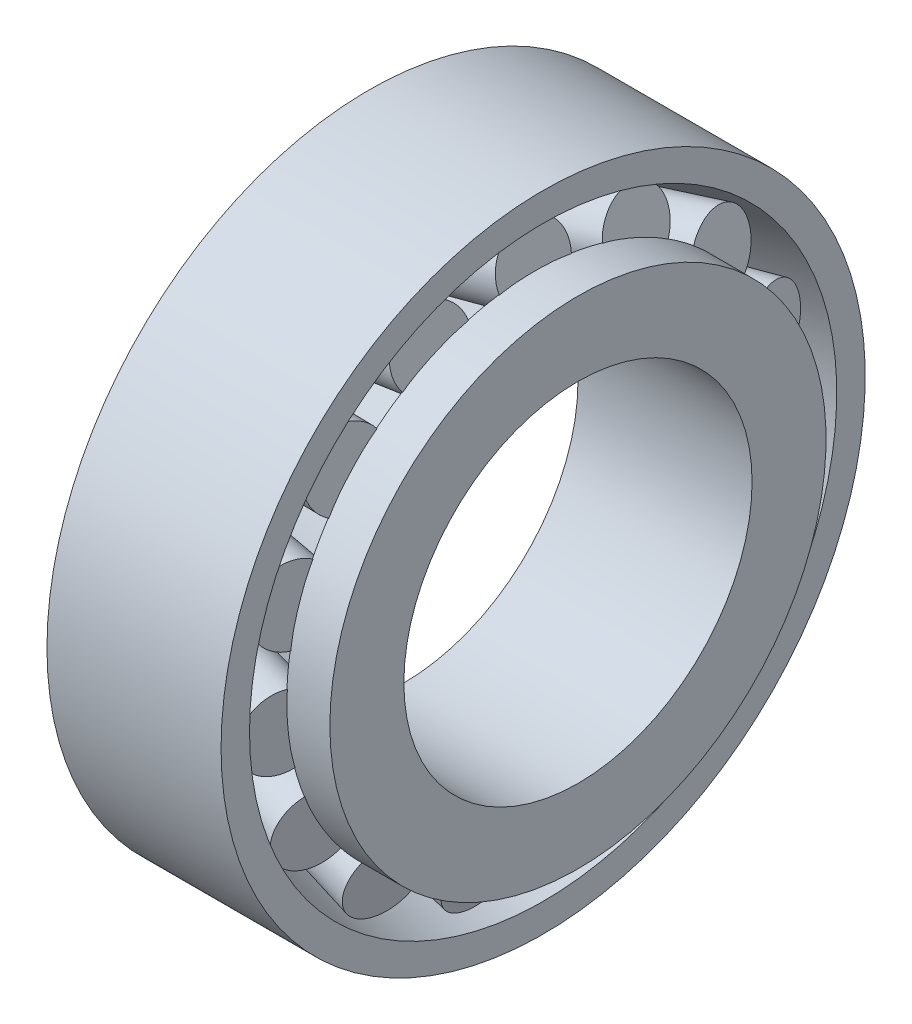
from build123d import *

# Parameters (mm, degrees)
PATTERN_CIRCULAR_1_COUNT = 15


with BuildPart() as part:
    # 草图3 → 旋转1 (revolve)
    with BuildSketch(Plane.XY):
        Polygon((0, 18.5), (10, 18.5), (10, 16.865646139), (0, 14.186154215), align=None)
        Polygon((2, 10), (12, 10), (12, 14.25), (9.521904251, 14.25), (10, 12.465722372), (3.851486845, 10.818233238), (3.5, 12.13), (2, 12.13), align=None)
    revolve(axis=Axis((0, 0, 0), (1, 0, 0)))

    # 草图4 → 旋转3 (revolve)
    with BuildSketch(Plane.XY):
        Polygon((3.858557912, 10.830480686), (3.311155632, 12.873413809), (9.440350271, 14.515726563), (9.987752551, 12.47279344), align=None)
    revolve_3 = revolve(axis=Axis((9.440350271, 14.515726563, 0), (-0.965925826289068, -0.25881904510252224, 0)))

    # 阵列(圆周)1: 旋转3 ×15 about axis
    pattern_circular_1_axis = Axis((0, 0, 0), (-1, 0, 0))
    for i in range(1, PATTERN_CIRCULAR_1_COUNT):
        add(revolve_3.rotate(pattern_circular_1_axis, i * 360 / PATTERN_CIRCULAR_1_COUNT))


solid = part.part
